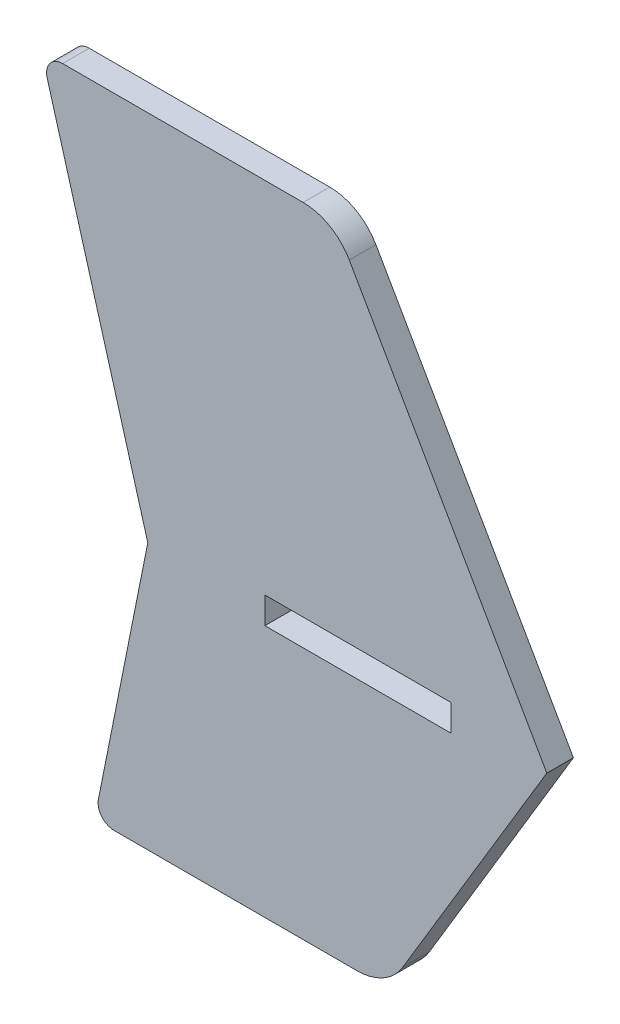
from build123d import *

# Parameters (mm, degrees)
GRUNDPLATTE_DEPTH      = 5
SKIZZE2_W              = 35
SKIZZE2_H              = 5
NUTH_HENLEITWERK_DEPTH = 15
VERRUNDUNG1_R          = 10
VERRUNDUNG2_R          = 3


with BuildPart() as part:
    # Skizze1 → Grundplatte (new body)
    with BuildSketch(Plane.XY):
        Polygon((-35, 120), (20, 120), (60, 50), (30, 0), (0, 0), (-25, 0), (-15, 50), align=None)
    extrude(amount=GRUNDPLATTE_DEPTH)

    # Skizze2 → NutHöhenleitwerk (cut)
    with BuildSketch(Plane.XY.offset(5)):
        with Locations((24.5, 50)):
            Rectangle(SKIZZE2_W, SKIZZE2_H)
    extrude(amount=-NUTH_HENLEITWERK_DEPTH, mode=Mode.SUBTRACT)

    # Verrundung1
    verrundung1_edges = [part.edges().sort_by_distance(p)[0] for p in [
        (30, 0, 2.5),
        (20, 120, 2.5),
    ]]
    fillet(verrundung1_edges, radius=VERRUNDUNG1_R)

    # Verrundung2
    verrundung2_edges = [part.edges().sort_by_distance(p)[0] for p in [
        (-25, 0, 2.5),
        (-35, 120, 2.5),
    ]]
    fillet(verrundung2_edges, radius=VERRUNDUNG2_R)


solid = part.part
